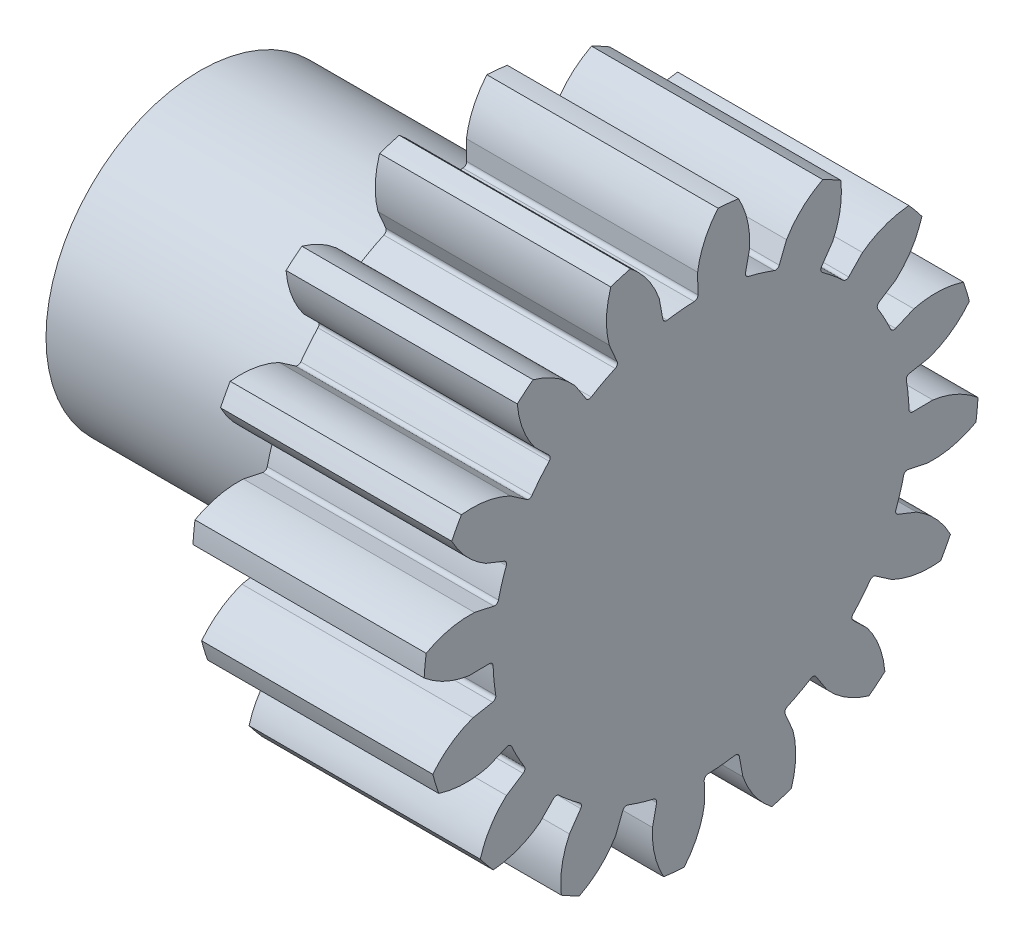
from build123d import *

# Parameters (mm, degrees)
SKETCH_2_R                       = 5.4
EXTRUDE_2_DEPTH                  = 6
SKETCH_5_R                       = 4
EXTRUDE_4_DEPTH                  = 7
HOLE_WIZARD_M31_D                = 2.5
HOLE_WIZARD_M31_DEPTH            = 8.5
HOLE_WIZARD_M31_CSINK_D          = 5
HOLE_WIZARD_M31_CSINK_ANGLE      = 90
HOLE_WIZARD_M31_TIP              = 0.751075774
EXTRUDE_5_REACH                  = 14.583
EXTRUDE_5_DIRECTION_2_REACH      = 14.583
FILLET_4_R                       = 0.1
PATTERN_CIRCULAR_1_COUNT         = 16
FILLET_4_OF_PATTERN_CIRCULAR_1_R = 0.1
FILLET_5_R                       = 0.2


with BuildPart() as part:
    # Эскиз2 → Бобышка-Вытянуть2 (new body)
    with BuildSketch(Plane(origin=(0, 0, 0), x_dir=(0, 0, -1), z_dir=(1, 0, 0))):
        Circle(SKETCH_2_R)
    extrude(amount=EXTRUDE_2_DEPTH)

    # Эскиз5 → Бобышка-Вытянуть4 (add)
    with BuildSketch(Plane.ZY):
        Circle(SKETCH_5_R)
    extrude(amount=EXTRUDE_4_DEPTH)

    # Отверстие обработанное метчиком M31
    with Locations(Plane.ZY.offset(7)):
        with Locations((0, 0)):
            CounterSinkHole(HOLE_WIZARD_M31_D / 2, HOLE_WIZARD_M31_CSINK_D / 2, depth=HOLE_WIZARD_M31_DEPTH, counter_sink_angle=HOLE_WIZARD_M31_CSINK_ANGLE)
            with Locations((0, 0, -(HOLE_WIZARD_M31_DEPTH + HOLE_WIZARD_M31_TIP / 2))):  # 118° drill point
                Cone(0, HOLE_WIZARD_M31_D / 2, HOLE_WIZARD_M31_TIP, mode=Mode.SUBTRACT)

    # Бобышка-Вытянуть5: up to this face of the body (flat: up to its plane)
    extrude_5_end = Plane(part.part.faces().sort_by_distance((6, 0, 0))[0])
    # Эскиз9 → Бобышка-Вытянуть5 (add, up to the picked face)
    with BuildSketch(Plane(origin=(3, 0, 0), x_dir=(0, 0, -1), z_dir=(1, 0, 0)), mode=Mode.PRIVATE) as extrude_5_sk1:
        with BuildLine():
            Line((-0.089632134, 6.013364805), (-0.080480693, 5.399400231))
            ThreePointArc((-0.080480693, 5.399400231), (0.529292558, 5.373997524), (1.132305009, 5.279951266))
            Line((1.132305009, 5.279951266), (1.261059154, 5.880333324))
            add(Edge.make_bspline(
                [(1.261059154, 5.880333324), (1.295696363, 6.538751311), (0.970178552, 7.134336239)],
                knots=[0, 0, 0, 1, 1, 1], degree=2))
            ThreePointArc((0.970178552, 7.134336239), (0.70572341, 7.165330032), (0.440303111, 7.186524415))
            add(Edge.make_bspline(
                [(-0.089632134, 6.013364805), (0.004847178, 6.665888859), (0.440303111, 7.186524415)],
                knots=[0, 0, 0, 1, 1, 1], degree=2))
        make_face()
    extrude_5_tool1 = split(extrude(extrude_5_sk1.sketch, amount=EXTRUDE_5_REACH, mode=Mode.PRIVATE), bisect_by=extrude_5_end, keep=Keep.BOTH, mode=Mode.PRIVATE)
    extrude_5 = extrude_5_tool1.solids().sort_by(Axis((3, 6.178183, -0.608498), (1, 0, 0)))[0]
    add(extrude_5)

    # Бобышка-Вытянуть5 direction 2: up to this face of the body (flat: up to its plane)
    extrude_5_direction_2_end = Plane(part.part.faces().sort_by_distance((0, 0, 5.247264935))[0])
    # Эскиз9 → Бобышка-Вытянуть5 direction 2 (add, up to the picked face)
    with BuildSketch(Plane(origin=(3, 0, 0), x_dir=(0, 0, -1), z_dir=(1, 0, 0)), mode=Mode.PRIVATE) as extrude_5_direction_2_sk1:
        with BuildLine():
            Line((-0.089632134, 6.013364805), (-0.080480693, 5.399400231))
            ThreePointArc((-0.080480693, 5.399400231), (0.529292558, 5.373997524), (1.132305009, 5.279951266))
            Line((1.132305009, 5.279951266), (1.261059154, 5.880333324))
            add(Edge.make_bspline(
                [(1.261059154, 5.880333324), (1.295696363, 6.538751311), (0.970178552, 7.134336239)],
                knots=[0, 0, 0, 1, 1, 1], degree=2))
            ThreePointArc((0.970178552, 7.134336239), (0.70572341, 7.165330032), (0.440303111, 7.186524415))
            add(Edge.make_bspline(
                [(-0.089632134, 6.013364805), (0.004847178, 6.665888859), (0.440303111, 7.186524415)],
                knots=[0, 0, 0, 1, 1, 1], degree=2))
        make_face()
    extrude_5_direction_2_tool1 = split(extrude(extrude_5_direction_2_sk1.sketch, amount=-EXTRUDE_5_DIRECTION_2_REACH, mode=Mode.PRIVATE), bisect_by=extrude_5_direction_2_end, keep=Keep.BOTH, mode=Mode.PRIVATE)
    extrude_5_direction_2 = extrude_5_direction_2_tool1.solids().sort_by(Axis((3, 6.178183, -0.608498), (-1, 0, 0)))[0]
    add(extrude_5_direction_2)

    # Скругление4
    fillet_4_edges = [part.edges().sort_by_distance(p)[0] for p in [
        (3, 5.399400231, 0.080480693),
        (3, 5.279951266, -1.132305009),
    ]]
    fillet(fillet_4_edges, radius=FILLET_4_R)

    # Круговой массив1: Бобышка-Вытянуть5, Бобышка-Вытянуть5 direction 2 ×16 about axis
    pattern_circular_1_axis = Axis((6, 0, 0), (-1, 0, 0))
    add([extrude_5.rotate(pattern_circular_1_axis, i * 360 / PATTERN_CIRCULAR_1_COUNT) for i in range(1, PATTERN_CIRCULAR_1_COUNT)])
    add([extrude_5_direction_2.rotate(pattern_circular_1_axis, i * 360 / PATTERN_CIRCULAR_1_COUNT) for i in range(1, PATTERN_CIRCULAR_1_COUNT)])

    # Скругление4 of Круговой массив1
    fillet_4_of_pattern_circular_1_edges = [part.edges().sort_by_distance(p)[0] for p in [
        (3, 5.019193989, -1.991906548),
        (3, 4.44472454, -3.066663295),
        (3, 3.874860962, -3.761044074),
        (3, 2.932828794, -4.534149894),
        (3, 2.140615478, -4.957596734),
        (3, 0.974436451, -5.311353274),
        (3, 0.080480693, -5.399400231),
        (3, -1.132305009, -5.279951266),
        (3, -1.991906548, -5.019193989),
        (3, -3.066663295, -4.44472454),
        (3, -3.761044074, -3.874860962),
        (3, -4.534149894, -2.932828794),
        (3, -4.957596734, -2.140615478),
        (3, -5.311353274, -0.974436451),
        (3, -5.399400231, -0.080480693),
        (3, -5.279951266, 1.132305009),
        (3, -5.019193989, 1.991906548),
        (3, -4.44472454, 3.066663295),
        (3, -3.874860962, 3.761044074),
        (3, -2.932828794, 4.534149894),
        (3, -2.140615478, 4.957596734),
        (3, -0.974436451, 5.311353274),
        (3, -0.080480693, 5.399400231),
        (3, 1.132305009, 5.279951266),
        (3, 1.991906548, 5.019193989),
        (3, 3.066663295, 4.44472454),
        (3, 3.761044074, 3.874860962),
        (3, 4.534149894, 2.932828794),
        (3, 4.957596734, 2.140615478),
        (3, 5.311353274, 0.974436451),
    ]]
    fillet(fillet_4_of_pattern_circular_1_edges, radius=FILLET_4_OF_PATTERN_CIRCULAR_1_R)

    # Эскиз11 → Вырез-Повернуть3 (revolve, cut)
    with BuildSketch(Plane.XY):
        Polygon((0, 4), (0, 3.7), (-0.5, 3.7), (-0.8, 4), align=None)
    revolve(axis=Axis((-7, 0, 0), (1, 0, 0)), mode=Mode.SUBTRACT)

    # Скругление5
    fillet_5_edges = [part.edges().sort_by_distance(p)[0] for p in [
        (-0.5, -3.7, 0),
        (0, -3.7, 0),
    ]]
    fillet(fillet_5_edges, radius=FILLET_5_R)


solid = part.part
